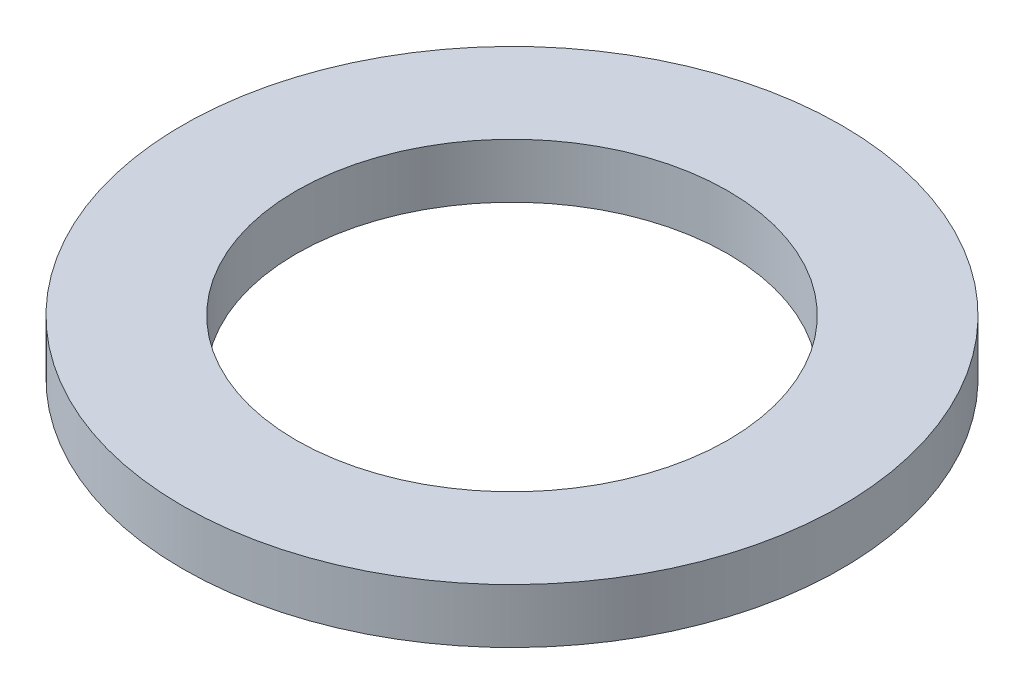
from build123d import *

# Parameters (mm, degrees)
SKETCH1_R           = 72.5
BOSS_EXTRUDE1_DEPTH = 12
SKETCH2_R           = 47.5
CUT_EXTRUDE1_DEPTH  = 104.230325002


with BuildPart() as part:
    # Sketch1 → Boss-Extrude1 (new body)
    with BuildSketch(Plane(origin=(0, 0, 0), x_dir=(1, 0, 0), z_dir=(0, 1, 0))):
        Circle(SKETCH1_R)
    extrude(amount=BOSS_EXTRUDE1_DEPTH)

    # Sketch2 → Cut-Extrude1 (cut, through all)
    with BuildSketch(Plane(origin=(0, 0, 0), x_dir=(1, 0, 0), z_dir=(0, 1, 0))):
        Circle(SKETCH2_R)
    extrude(amount=CUT_EXTRUDE1_DEPTH, mode=Mode.SUBTRACT)


solid = part.part
